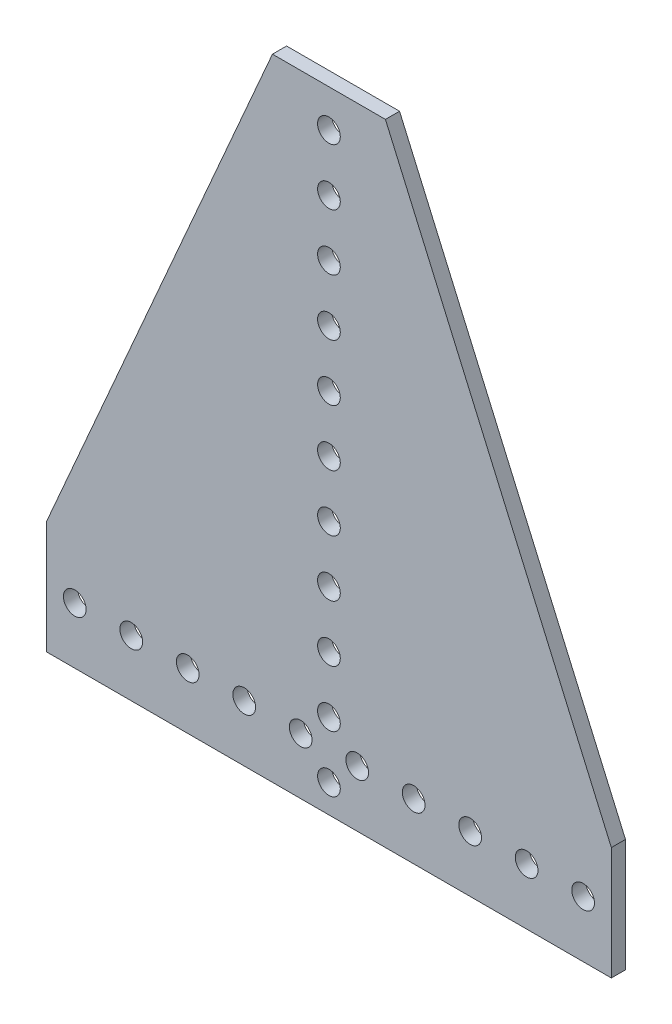
from build123d import *

# Parameters (mm, degrees)
SKETCH1_W           = 177.8
SKETCH1_H           = 254
BOSS_EXTRUDE1_DEPTH = 3.175
SKETCH2_R           = 2.5527
CUT_EXTRUDE1_DEPTH  = 189.739304517
SKETCH3_R           = 2.5527
CUT_EXTRUDE2_DEPTH  = 189.739304517
CUT_EXTRUDE3_DEPTH  = 189.739304517


with BuildPart() as part:
    # Sketch1 → Boss-Extrude1 (new body)
    with BuildSketch(Plane.XY):
        with Locations((-39.1, 11.666666667)):
            Rectangle(SKETCH1_W, SKETCH1_H)
    extrude(amount=BOSS_EXTRUDE1_DEPTH)

    # Sketch2 → Cut-Extrude1 (cut, through all)
    with BuildSketch(Plane.XY.offset(3.175)):
        with Locations((-39.1, -108.983333333)):
            Circle(SKETCH2_R)
        with Locations((-39.1, -96.283333333)):
            Circle(SKETCH2_R)
        with Locations((-39.1, -83.583333333)):
            Circle(SKETCH2_R)
        with Locations((-39.1, -70.883333333)):
            Circle(SKETCH2_R)
        with Locations((-39.1, -58.183333333)):
            Circle(SKETCH2_R)
        with Locations((-39.1, -45.483333333)):
            Circle(SKETCH2_R)
        with Locations((-39.1, -32.783333333)):
            Circle(SKETCH2_R)
        with Locations((-39.1, -20.083333333)):
            Circle(SKETCH2_R)
        with Locations((-39.1, -7.383333333)):
            Circle(SKETCH2_R)
        with Locations((-39.1, 5.316666667)):
            Circle(SKETCH2_R)
        with Locations((-39.1, 18.016666667)):
            Circle(SKETCH2_R)
        with Locations((-39.1, 30.716666667)):
            Circle(SKETCH2_R)
    extrude(amount=-CUT_EXTRUDE1_DEPTH, mode=Mode.SUBTRACT)

    # Sketch3 → Cut-Extrude2 (cut, through all)
    with BuildSketch(Plane.XY.offset(3.175)):
        with Locations((30.75, -102.633333333)):
            Circle(SKETCH3_R)
        with Locations((18.05, -102.633333333)):
            Circle(SKETCH3_R)
        with Locations((5.35, -102.633333333)):
            Circle(SKETCH3_R)
        with Locations((-7.35, -102.633333333)):
            Circle(SKETCH3_R)
        with Locations((-20.05, -102.633333333)):
            Circle(SKETCH3_R)
        with Locations((-32.75, -102.633333333)):
            Circle(SKETCH3_R)
        with Locations((-45.45, -102.633333333)):
            Circle(SKETCH3_R)
        with Locations((-58.15, -102.633333333)):
            Circle(SKETCH3_R)
        with Locations((-70.85, -102.633333333)):
            Circle(SKETCH3_R)
        with Locations((-83.55, -102.633333333)):
            Circle(SKETCH3_R)
        with Locations((-96.25, -102.633333333)):
            Circle(SKETCH3_R)
        with Locations((-108.95, -102.633333333)):
            Circle(SKETCH3_R)
    extrude(amount=-CUT_EXTRUDE2_DEPTH, mode=Mode.SUBTRACT)

    # Sketch4 → Cut-Extrude3 (cut, through all)
    with BuildSketch(Plane.XY.offset(3.175)):
        Polygon((-128, -115.333333333), (-102.6, -115.333333333), (-102.6, -89.933333333), (-51.8, 26.464089319), (-26.4, 26.464089319), (24.4, -89.933333333), (24.4, -115.333333333), (49.8, -115.333333333), (49.8, 138.666666667), (-128, 138.666666667), align=None)
    extrude(amount=-CUT_EXTRUDE3_DEPTH, mode=Mode.SUBTRACT)


solid = part.part
